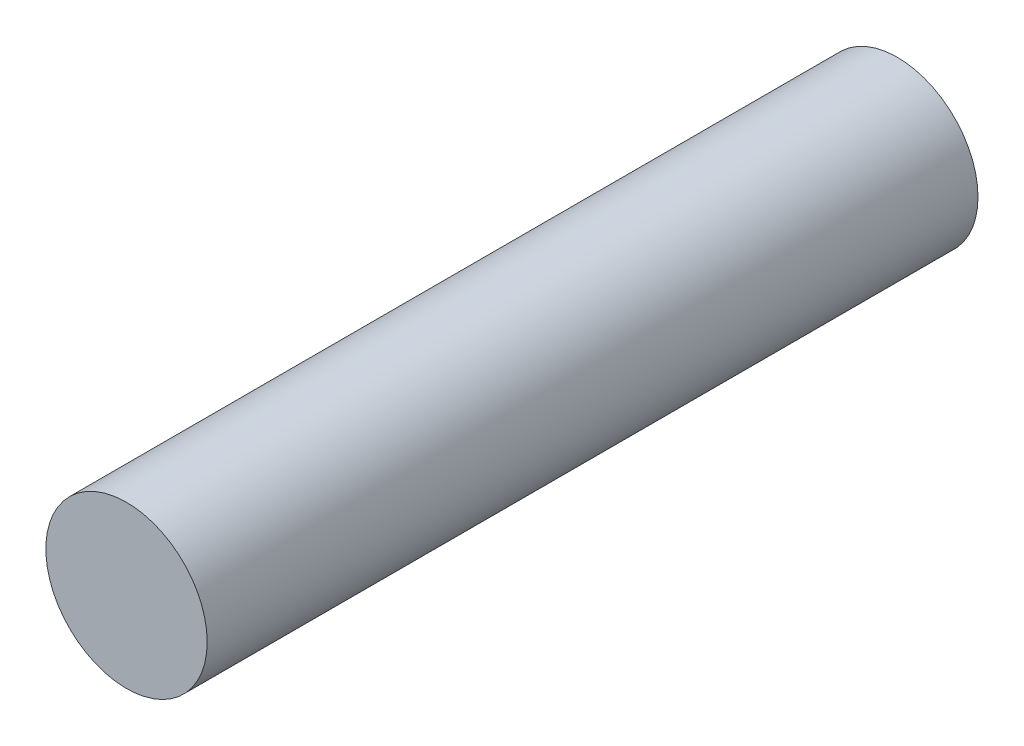
from build123d import *

# Parameters (mm, degrees)
BOSS_EXTRUDE1_DEPTH      = 8
BOSS_EXTRUDE1_DEPTH_BACK = 13.5
SKETCH1_R                = 2.25


with BuildPart() as part:
    # Sketch1 → Boss-Extrude1 (new, two sides: drawn at the far end of the back side and taken through both)
    with BuildSketch(Plane.XY.offset(-BOSS_EXTRUDE1_DEPTH_BACK)):
        Circle(SKETCH1_R)
    extrude(amount=BOSS_EXTRUDE1_DEPTH + BOSS_EXTRUDE1_DEPTH_BACK)


solid = part.part
